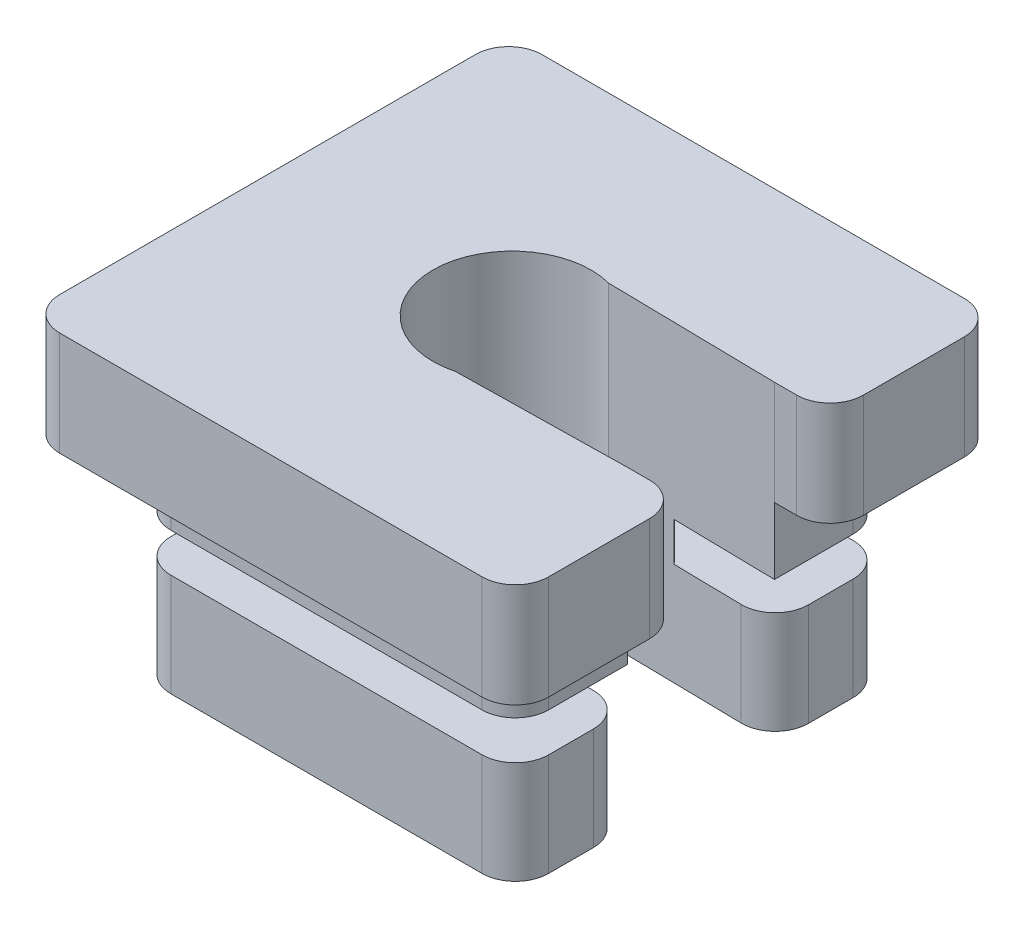
from build123d import *

# Parameters (mm, degrees)
BOSS_EXTRUDE1_DEPTH = 9.525
BOSS_EXTRUDE2_DEPTH = 4.7625
CUT_EXTRUDE1_DEPTH  = 1.778
FILLET1_R           = 1.524


with BuildPart() as part:
    # Sketch2 → Boss-Extrude1 (new body)
    with BuildSketch(Plane(origin=(0, 0, 0), x_dir=(1, 0, 0), z_dir=(0, 1, 0))):
        with BuildLine():
            Line((8.64, 8.4876), (-8.64, 8.4876))
            Line((-8.64, 8.4876), (-8.64, -8.4876))
            Line((-8.64, -8.4876), (8.64, -8.4876))
            Line((8.64, -8.4876), (8.64, -3.3655))
            Line((8.64, -3.3655), (0.921517153, -3.500226619))
            ThreePointArc((0.921517153, -3.500226619), (-3.6195, 0), (0.921517153, 3.500226619))
            Line((0.921517153, 3.500226619), (8.64, 3.3655))
            Line((8.64, 3.3655), (8.64, 8.4876))
        make_face()
    extrude(amount=BOSS_EXTRUDE1_DEPTH)

    # Sketch3 → Boss-Extrude2 (add)
    with BuildSketch(Plane(origin=(0, 9.525, 0), x_dir=(1, 0, 0), z_dir=(0, 1, 0))):
        with BuildLine():
            Line((11.18, 3.3655), (11.18, 11.0276))
            Line((11.18, 11.0276), (-11.18, 11.0276))
            Line((-11.18, 11.0276), (-11.18, -11.0276))
            Line((-11.18, -11.0276), (11.18, -11.0276))
            Line((11.18, -11.0276), (11.18, -3.3655))
            Line((11.18, -3.3655), (8.64, -3.3655))
            Line((8.64, -3.3655), (0.921517153, -3.500226619))
            ThreePointArc((0.921517153, -3.500226619), (-3.6195, 0), (0.921517153, 3.500226619))
            Line((0.921517153, 3.500226619), (8.64, 3.3655))
            Line((8.64, 3.3655), (11.18, 3.3655))
        make_face()
    extrude(amount=BOSS_EXTRUDE2_DEPTH)

    # Sketch4 → Cut-Extrude1 (cut)
    with BuildSketch(Plane(origin=(0, 6.477, 0), x_dir=(-1, 0, 0), z_dir=(0, -1, 0))):
        with BuildLine():
            Line((-8.64, 8.4876), (-8.64, 3.3655))
            Line((-8.64, 3.3655), (-3.970210665, 3.447011476))
            ThreePointArc((-3.970210665, 3.447011476), (5.2578, 0), (-3.970210665, -3.447011476))
            Line((-3.970210665, -3.447011476), (-8.64, -3.3655))
            Line((-8.64, -3.3655), (-8.64, -8.4876))
            Line((-8.64, -8.4876), (8.64, -8.4876))
            Line((8.64, -8.4876), (8.64, 8.4876))
            Line((8.64, 8.4876), (-8.64, 8.4876))
        make_face()
    extrude(amount=CUT_EXTRUDE1_DEPTH, mode=Mode.SUBTRACT)

    # Fillet1
    fillet1_edges = [part.edges().sort_by_distance(p)[0] for p in [
        (-11.18, 11.90625, 11.0276),
        (-8.64, 8.001, 8.4876),
        (8.64, 8.001, -8.4876),
        (8.64, 8.001, 8.4876),
        (11.18, 11.90625, 11.0276),
        (11.18, 11.90625, -11.0276),
        (-11.18, 11.90625, -11.0276),
        (-8.64, 8.001, -8.4876),
        (-8.64, 2.3495, -8.4876),
        (8.64, 2.3495, -8.4876),
        (-8.64, 2.3495, 8.4876),
        (8.64, 2.3495, 8.4876),
        (8.64, 2.3495, -3.3655),
        (8.64, 2.3495, 3.3655),
        (11.18, 11.90625, -3.3655),
        (11.18, 11.90625, 3.3655),
    ]]
    fillet(fillet1_edges, radius=FILLET1_R)


solid = part.part
